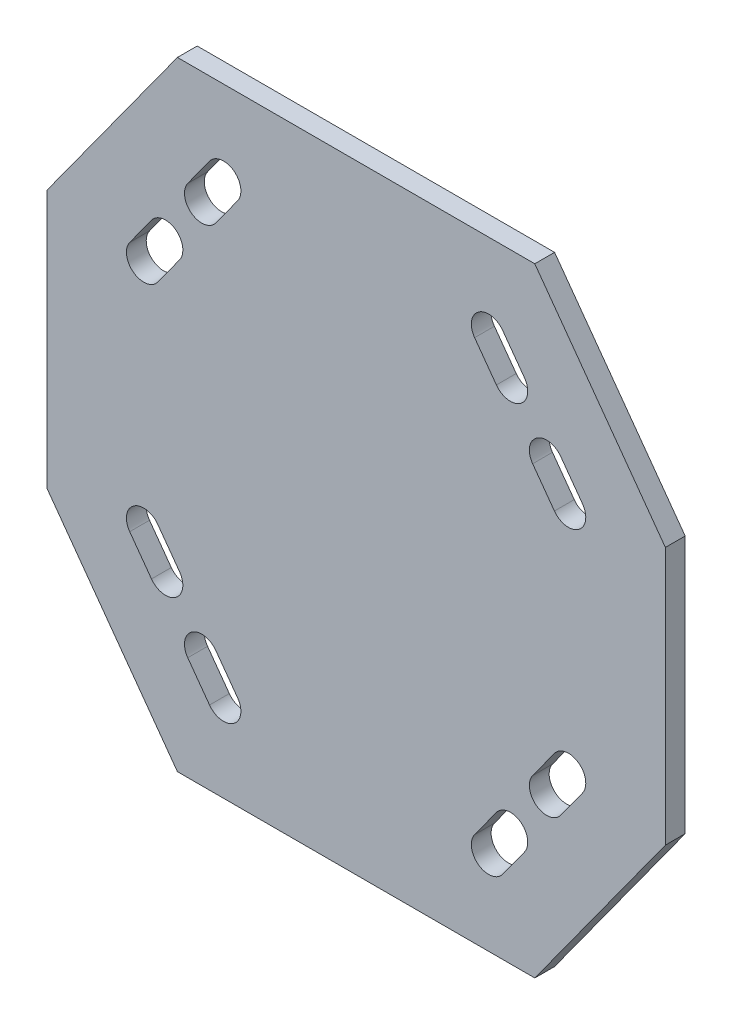
from build123d import *

# Parameters (mm, degrees)
SKETCH_1_W             = 250
SKETCH_1_H             = 250
SM_BASE_FLANGE_1_DEPTH = 8
CUT_EXTRUDE_1_DEPTH    = 10
CUT_EXTRUDE_2_DEPTH    = 10


# Sheet-metal steps are written as plain solids
with BuildPart() as part:
    # Sketch 1 → Базовая кромка1 (new body)
    with BuildSketch(Plane.XY):
        with Locations((125, -125)):
            Rectangle(SKETCH_1_W, SKETCH_1_H)
    extrude(amount=-SM_BASE_FLANGE_1_DEPTH)

    # Sketch 2 → Вырез-Вытянуть1 (cut)
    with BuildSketch(Plane.XY):
        Polygon((52.778688881, 0), (0, -72.9), (0, 0), align=None)
        Polygon((250, 0), (197.221311119, 0), (250, -72.9), align=None)
        Polygon((197.221311119, -250), (250, -177.1), (250, -250), align=None)
        Polygon((0, -250), (52.778688881, -250), (0, -177.1), align=None)
    extrude(amount=-CUT_EXTRUDE_1_DEPTH, mode=Mode.SUBTRACT)

    # Эскиз3 → Вырез-Вытянуть2 (cut)
    with BuildSketch(Plane(origin=(0, 0, -8), x_dir=(-1, 0, 0), z_dir=(0, 0, -1))):
        with BuildLine():
            Line((-65.757289426, -29.819990865), (-56.960841279, -41.969990865))
            ThreePointArc((-56.960841279, -41.969990865), (-58.525832144, -51.745), (-68.300841279, -50.180009135))
            Line((-68.300841279, -50.180009135), (-77.097289426, -38.030009135))
            ThreePointArc((-77.097289426, -38.030009135), (-75.532298561, -28.255), (-65.757289426, -29.819990865))
        make_face()
        with BuildLine():
            Line((-42.300094368, -62.219990865), (-33.503646221, -74.369990865))
            ThreePointArc((-33.503646221, -74.369990865), (-35.068637085, -84.145), (-44.843646221, -82.580009135))
            Line((-44.843646221, -82.580009135), (-53.640094368, -70.430009135))
            ThreePointArc((-53.640094368, -70.430009135), (-52.075103503, -60.655), (-42.300094368, -62.219990865))
        make_face()
        with BuildLine():
            Line((-184.242710574, -29.819990865), (-193.039158721, -41.969990865))
            ThreePointArc((-193.039158721, -41.969990865), (-191.474167856, -51.745), (-181.699158721, -50.180009135))
            Line((-181.699158721, -50.180009135), (-172.902710574, -38.030009135))
            ThreePointArc((-172.902710574, -38.030009135), (-174.467701439, -28.255), (-184.242710574, -29.819990865))
        make_face()
        with BuildLine():
            Line((-207.699905632, -62.219990865), (-216.496353779, -74.369990865))
            ThreePointArc((-216.496353779, -74.369990865), (-214.931362915, -84.145), (-205.156353779, -82.580009135))
            Line((-205.156353779, -82.580009135), (-196.359905632, -70.430009135))
            ThreePointArc((-196.359905632, -70.430009135), (-197.924896497, -60.655), (-207.699905632, -62.219990865))
        make_face()
        with BuildLine():
            Line((-65.757289426, -220.180009135), (-56.960841279, -208.030009135))
            ThreePointArc((-56.960841279, -208.030009135), (-58.525832144, -198.255), (-68.300841279, -199.819990865))
            Line((-68.300841279, -199.819990865), (-77.097289426, -211.969990865))
            ThreePointArc((-77.097289426, -211.969990865), (-75.532298561, -221.745), (-65.757289426, -220.180009135))
        make_face()
        with BuildLine():
            Line((-42.300094368, -187.780009135), (-33.503646221, -175.630009135))
            ThreePointArc((-33.503646221, -175.630009135), (-35.068637085, -165.855), (-44.843646221, -167.419990865))
            Line((-44.843646221, -167.419990865), (-53.640094368, -179.569990865))
            ThreePointArc((-53.640094368, -179.569990865), (-52.075103503, -189.345), (-42.300094368, -187.780009135))
        make_face()
        with BuildLine():
            Line((-184.242710574, -220.180009135), (-193.039158721, -208.030009135))
            ThreePointArc((-193.039158721, -208.030009135), (-191.474167856, -198.255), (-181.699158721, -199.819990865))
            Line((-181.699158721, -199.819990865), (-172.902710574, -211.969990865))
            ThreePointArc((-172.902710574, -211.969990865), (-174.467701439, -221.745), (-184.242710574, -220.180009135))
        make_face()
        with BuildLine():
            Line((-207.699905632, -187.780009135), (-216.496353779, -175.630009135))
            ThreePointArc((-216.496353779, -175.630009135), (-214.931362915, -165.855), (-205.156353779, -167.419990865))
            Line((-205.156353779, -167.419990865), (-196.359905632, -179.569990865))
            ThreePointArc((-196.359905632, -179.569990865), (-197.924896497, -189.345), (-207.699905632, -187.780009135))
        make_face()
    extrude(amount=-CUT_EXTRUDE_2_DEPTH, mode=Mode.SUBTRACT)


solid = part.part
